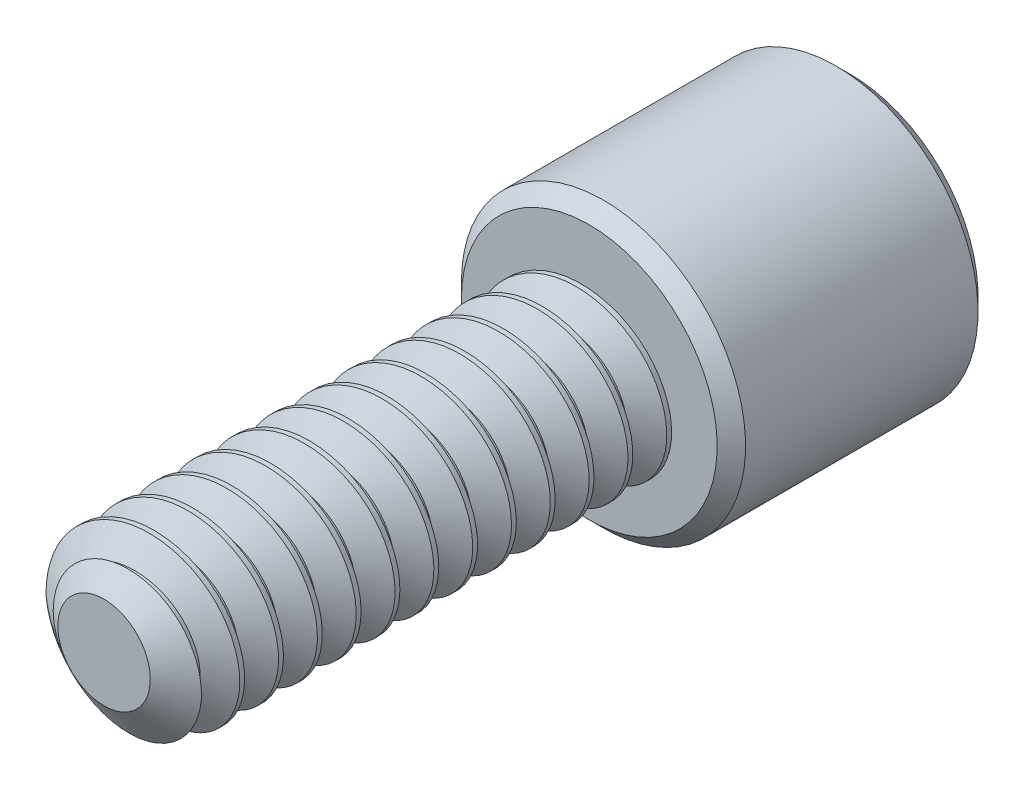
from build123d import *

# Parameters (mm, degrees)
SKETCH1_R          = 1.4224
EXTRUDE1_DEPTH     = 7.9375
CUT_SWEEP1_PITCH   = 0.635
SKETCH6_R          = 2.3241
EXTRUDE2_DEPTH     = 4.2672
CUT_EXTRUDE1_DEPTH = 1.7859375
CHAMFER1_SIZE      = 0.23241


with BuildPart() as part:
    # Sketch1 → Extrude1 (new body)
    with BuildSketch(Plane.XY):
        Circle(SKETCH1_R)
    extrude(amount=-EXTRUDE1_DEPTH)

    # Cut-Sweep1: the profile of Sketch3 profile screwed along a right-hand helix of 13.5 turns, 6 arcs to a turn; built about Z, then put on its axis
    cut_sweep1_z = Axis((0, 0, 0), (0, 0, 1))
    cut_sweep1_corners = [(1.4227, 0, -0.555798205), (1.009955401, 0, -0.3175), (1.009955401, 0, -0.238125), (1.4227, 0, 0.000173205)]
    with BuildLine(mode=Mode.PRIVATE) as cut_sweep1_profile:
        Line(cut_sweep1_corners[0], cut_sweep1_corners[1])
        Line(cut_sweep1_corners[1], cut_sweep1_corners[2])
        Line(cut_sweep1_corners[2], cut_sweep1_corners[3])
        Line(cut_sweep1_corners[3], cut_sweep1_corners[0])
    cut_sweep1_cap = Face(cut_sweep1_profile.wire())
    cut_sweep1_turn_angles = [0, 30, 60, 90, 120, 150, 180, 210, 240, 270, 300, 330, 360]
    cut_sweep1_turn_weights = [1, 0.8660254037844387, 1, 0.8660254037844387, 1, 0.8660254037844387, 1, 0.8660254037844387, 1, 0.8660254037844387, 1, 0.8660254037844387, 1]
    cut_sweep1_turn_rails = [Edge.make_bspline([Vector(p[0], p[1], 0).rotate(cut_sweep1_z, cut_sweep1_turn_angles[k]) / cut_sweep1_turn_weights[k] + Vector(0, 0, p[2] + CUT_SWEEP1_PITCH * cut_sweep1_turn_angles[k] / 360) for k in range(13)], [0, 0, 0, 1, 1, 2, 2, 3, 3, 4, 4, 5, 5, 6, 6, 6], 2, cut_sweep1_turn_weights) for p in cut_sweep1_corners]
    cut_sweep1_turn_sides = [Face.make_surface_from_curves(cut_sweep1_turn_rails[p[0]], cut_sweep1_turn_rails[p[1]]) for p in [(0, 1), (1, 2), (2, 3), (3, 0)]]
    cut_sweep1_last_angles = [4680, 4710, 4740, 4770, 4800, 4830, 4860]
    cut_sweep1_last_weights = [1, 0.8660254037844387, 1, 0.8660254037844387, 1, 0.8660254037843632, 1]
    cut_sweep1_last_rails = [Edge.make_bspline([Vector(p[0], p[1], 0).rotate(cut_sweep1_z, cut_sweep1_last_angles[k]) / cut_sweep1_last_weights[k] + Vector(0, 0, p[2] + CUT_SWEEP1_PITCH * cut_sweep1_last_angles[k] / 360) for k in range(7)], [0, 0, 0, 1, 1, 2, 2, 3, 3, 3], 2, cut_sweep1_last_weights) for p in cut_sweep1_corners]
    cut_sweep1_last_sides = [Face.make_surface_from_curves(cut_sweep1_last_rails[p[0]], cut_sweep1_last_rails[p[1]]) for p in [(0, 1), (1, 2), (2, 3), (3, 0)]]
    cut_sweep1 = Plane(origin=(0, 0, 0), x_dir=(0, 1, 0), z_dir=(0, 0, -1)) * Solid(Shell([*[p.moved(Location((0, 0, CUT_SWEEP1_PITCH * i))) for i in range(13) for p in cut_sweep1_turn_sides], *cut_sweep1_last_sides, cut_sweep1_cap, cut_sweep1_cap.rotate(cut_sweep1_z, 4860).moved(Location((0, 0, CUT_SWEEP1_PITCH * 4860 / 360)))]))
    add(cut_sweep1, mode=Mode.SUBTRACT)

    # Sketch4 → Cut-Revolve1 (revolve, cut)
    with BuildSketch(Plane(origin=(0, 0, 0), x_dir=(0, 0, -1), z_dir=(1, 0, 0)), mode=Mode.PRIVATE) as cut_revolve1_sk:
        Polygon((0.466649532, 1.4224), (0, 0.755955401), (0, 1.4224), align=None)
    revolve(cut_revolve1_sk.sketch.rotate(Axis((0, 0, 0), (0, 0, -1)), 264.795368264), axis=Axis((0, 0, 0), (0, 0, -1)), mode=Mode.SUBTRACT)

    # Sketch6 → Extrude2 (add)
    with BuildSketch(Plane(origin=(0, 0, -7.9375), x_dir=(-1, 0, 0), z_dir=(0, 0, -1))):
        Circle(SKETCH6_R)
    extrude(amount=EXTRUDE2_DEPTH)

    # Sketch7 → Cut-Extrude1 (cut)
    with BuildSketch(Plane(origin=(0, 0, -12.2047), x_dir=(-1, 0, 0), z_dir=(0, 0, -1))):
        Polygon((0, 1.374815329), (-1.190625, 0.687407664), (-1.190625, -0.687407664), (0, -1.374815329), (1.190625, -0.687407664), (1.190625, 0.687407664), align=None)
    extrude(amount=-CUT_EXTRUDE1_DEPTH, mode=Mode.SUBTRACT)

    # Cut-Extrude2 cone 1 section (through the dimple's axis) → Cut-Extrude2 (revolve, cut)
    with BuildSketch(Plane(origin=(0, 0, -12.2047), x_dir=(0, 1, 0), z_dir=(1, 0, 0))):
        Polygon((0, 0), (1.374815329, 0), (0, 1.374815329), align=None)
    revolve(axis=Axis((0, 0, -12.2047), (0, 0, 1)), mode=Mode.SUBTRACT)

    # Chamfer1
    chamfer1_edges = [part.edges().sort_by_distance(p)[0] for p in [
        (2.3241, 0, -7.9375),
        (2.3241, 0, -12.2047),
    ]]
    chamfer(chamfer1_edges, length=CHAMFER1_SIZE)


solid = part.part
